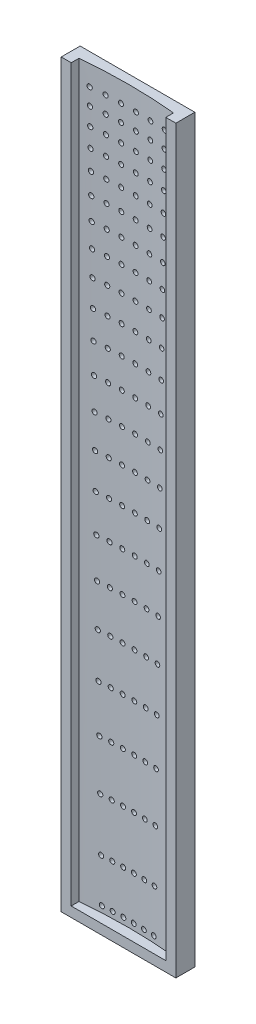
from build123d import *

# Parameters (mm, degrees)
SKETCH2_W               = 73.126
SKETCH2_H               = 465.703533893
BOSS_EXTRUDE1_DEPTH     = 12.8
SKETCH1_R               = 1.575
CUT_EXTRUDE1_DEPTH      = 12.8
CUT_EXTRUDE3_DEPTH      = 468.311966945
CUT_EXTRUDE3_DEPTH_BACK = 468.311966945
SKETCH4_W               = 73.126
SKETCH4_H               = 6.4
BOSS_EXTRUDE3_DEPTH     = 12.8
CHAMFER5_SIZE           = 0.7


with BuildPart() as part:
    # Sketch2 → Boss-Extrude1 (new body)
    with BuildSketch(Plane.XY):
        with Locations((0, 232.851766947)):
            Rectangle(SKETCH2_W, SKETCH2_H)
    extrude(amount=BOSS_EXTRUDE1_DEPTH)

    # Sketch1 → Cut-Extrude1 (cut)
    with BuildSketch(Plane.XY):
        with Locations((-16.5652, 4)):
            Circle(SKETCH1_R)
        with Locations((-9.9352, 4)):
            Circle(SKETCH1_R)
        with Locations((-3.3052, 4)):
            Circle(SKETCH1_R)
        with Locations((3.3248, 4)):
            Circle(SKETCH1_R)
        with Locations((9.9548, 4)):
            Circle(SKETCH1_R)
        with Locations((16.5848, 4)):
            Circle(SKETCH1_R)
        with Locations((-23.88043, 452.80915)):
            Circle(SKETCH1_R)
        with Locations((-14.33043, 452.80915)):
            Circle(SKETCH1_R)
        with Locations((-4.78043, 452.80915)):
            Circle(SKETCH1_R)
        with Locations((4.76957, 452.80915)):
            Circle(SKETCH1_R)
        with Locations((14.31957, 452.80915)):
            Circle(SKETCH1_R)
        with Locations((23.86957, 452.80915)):
            Circle(SKETCH1_R)
        with Locations((-23.707727265, 442.21337)):
            Circle(SKETCH1_R)
        with Locations((-14.227727265, 442.21337)):
            Circle(SKETCH1_R)
        with Locations((-4.747727265, 442.21337)):
            Circle(SKETCH1_R)
        with Locations((4.732272735, 442.21337)):
            Circle(SKETCH1_R)
        with Locations((14.212272735, 442.21337)):
            Circle(SKETCH1_R)
        with Locations((23.692272735, 442.21337)):
            Circle(SKETCH1_R)
        with Locations((-23.524755056, 430.98753)):
            Circle(SKETCH1_R)
        with Locations((-14.114755056, 430.98753)):
            Circle(SKETCH1_R)
        with Locations((-4.704755056, 430.98753)):
            Circle(SKETCH1_R)
        with Locations((4.705244944, 430.98753)):
            Circle(SKETCH1_R)
        with Locations((14.115244944, 430.98753)):
            Circle(SKETCH1_R)
        with Locations((23.525244944, 430.98753)):
            Circle(SKETCH1_R)
        with Locations((-23.330902805, 419.09417)):
            Circle(SKETCH1_R)
        with Locations((-14.000902805, 419.09417)):
            Circle(SKETCH1_R)
        with Locations((-4.670902805, 419.09417)):
            Circle(SKETCH1_R)
        with Locations((4.659097195, 419.09417)):
            Circle(SKETCH1_R)
        with Locations((13.989097195, 419.09417)):
            Circle(SKETCH1_R)
        with Locations((23.319097195, 419.09417)):
            Circle(SKETCH1_R)
        with Locations((-23.125523598, 406.4936)):
            Circle(SKETCH1_R)
        with Locations((-13.875523598, 406.4936)):
            Circle(SKETCH1_R)
        with Locations((-4.625523598, 406.4936)):
            Circle(SKETCH1_R)
        with Locations((4.624476402, 406.4936)):
            Circle(SKETCH1_R)
        with Locations((13.874476402, 406.4936)):
            Circle(SKETCH1_R)
        with Locations((23.124476402, 406.4936)):
            Circle(SKETCH1_R)
        with Locations((-22.907931725, 393.14375)):
            Circle(SKETCH1_R)
        with Locations((-13.747931725, 393.14375)):
            Circle(SKETCH1_R)
        with Locations((-4.587931725, 393.14375)):
            Circle(SKETCH1_R)
        with Locations((4.572068275, 393.14375)):
            Circle(SKETCH1_R)
        with Locations((13.732068275, 393.14375)):
            Circle(SKETCH1_R)
        with Locations((22.892068275, 393.14375)):
            Circle(SKETCH1_R)
        with Locations((-22.677401222, 379.00008)):
            Circle(SKETCH1_R)
        with Locations((-13.607401222, 379.00008)):
            Circle(SKETCH1_R)
        with Locations((-4.537401222, 379.00008)):
            Circle(SKETCH1_R)
        with Locations((4.532598778, 379.00008)):
            Circle(SKETCH1_R)
        with Locations((13.602598778, 379.00008)):
            Circle(SKETCH1_R)
        with Locations((22.672598778, 379.00008)):
            Circle(SKETCH1_R)
        with Locations((-22.433162766, 364.01539)):
            Circle(SKETCH1_R)
        with Locations((-13.463162766, 364.01539)):
            Circle(SKETCH1_R)
        with Locations((-4.493162766, 364.01539)):
            Circle(SKETCH1_R)
        with Locations((4.476837234, 364.01539)):
            Circle(SKETCH1_R)
        with Locations((13.446837234, 364.01539)):
            Circle(SKETCH1_R)
        with Locations((22.416837234, 364.01539)):
            Circle(SKETCH1_R)
        with Locations((-22.174401071, 348.13966)):
            Circle(SKETCH1_R)
        with Locations((-13.304401071, 348.13966)):
            Circle(SKETCH1_R)
        with Locations((-4.434401071, 348.13966)):
            Circle(SKETCH1_R)
        with Locations((4.435598929, 348.13966)):
            Circle(SKETCH1_R)
        with Locations((13.305598929, 348.13966)):
            Circle(SKETCH1_R)
        with Locations((22.175598929, 348.13966)):
            Circle(SKETCH1_R)
        with Locations((-21.900252606, 331.31991)):
            Circle(SKETCH1_R)
        with Locations((-13.140252606, 331.31991)):
            Circle(SKETCH1_R)
        with Locations((-4.380252606, 331.31991)):
            Circle(SKETCH1_R)
        with Locations((4.379747394, 331.31991)):
            Circle(SKETCH1_R)
        with Locations((13.139747394, 331.31991)):
            Circle(SKETCH1_R)
        with Locations((21.899747394, 331.31991)):
            Circle(SKETCH1_R)
        with Locations((-21.609802333, 313.5)):
            Circle(SKETCH1_R)
        with Locations((-12.969802333, 313.5)):
            Circle(SKETCH1_R)
        with Locations((-4.329802333, 313.5)):
            Circle(SKETCH1_R)
        with Locations((4.310197667, 313.5)):
            Circle(SKETCH1_R)
        with Locations((12.950197667, 313.5)):
            Circle(SKETCH1_R)
        with Locations((21.590197667, 313.5)):
            Circle(SKETCH1_R)
        with Locations((-21.302081101, 294.62047)):
            Circle(SKETCH1_R)
        with Locations((-12.781248101, 294.62047)):
            Circle(SKETCH1_R)
        with Locations((-4.260415101, 294.62047)):
            Circle(SKETCH1_R)
        with Locations((4.260417899, 294.62047)):
            Circle(SKETCH1_R)
        with Locations((12.781250899, 294.62047)):
            Circle(SKETCH1_R)
        with Locations((21.302083899, 294.62047)):
            Circle(SKETCH1_R)
        with Locations((-20.976061736, 274.6183)):
            Circle(SKETCH1_R)
        with Locations((-12.585636736, 274.6183)):
            Circle(SKETCH1_R)
        with Locations((-4.195211736, 274.6183)):
            Circle(SKETCH1_R)
        with Locations((4.195213264, 274.6183)):
            Circle(SKETCH1_R)
        with Locations((12.585638264, 274.6183)):
            Circle(SKETCH1_R)
        with Locations((20.976063264, 274.6183)):
            Circle(SKETCH1_R)
        with Locations((-20.630656266, 253.42674)):
            Circle(SKETCH1_R)
        with Locations((-12.378393266, 253.42674)):
            Circle(SKETCH1_R)
        with Locations((-4.126130266, 253.42674)):
            Circle(SKETCH1_R)
        with Locations((4.126132734, 253.42674)):
            Circle(SKETCH1_R)
        with Locations((12.378395734, 253.42674)):
            Circle(SKETCH1_R)
        with Locations((20.630658734, 253.42674)):
            Circle(SKETCH1_R)
        with Locations((-20.264712012, 230.97507)):
            Circle(SKETCH1_R)
        with Locations((-12.158827012, 230.97507)):
            Circle(SKETCH1_R)
        with Locations((-4.052942012, 230.97507)):
            Circle(SKETCH1_R)
        with Locations((4.052942988, 230.97507)):
            Circle(SKETCH1_R)
        with Locations((12.158827988, 230.97507)):
            Circle(SKETCH1_R)
        with Locations((20.264712988, 230.97507)):
            Circle(SKETCH1_R)
        with Locations((-19.87700751, 207.18835)):
            Circle(SKETCH1_R)
        with Locations((-11.92620451, 207.18835)):
            Circle(SKETCH1_R)
        with Locations((-3.97540151, 207.18835)):
            Circle(SKETCH1_R)
        with Locations((3.97540149, 207.18835)):
            Circle(SKETCH1_R)
        with Locations((11.92620449, 207.18835)):
            Circle(SKETCH1_R)
        with Locations((19.87700749, 207.18835)):
            Circle(SKETCH1_R)
        with Locations((-19.466248769, 181.98719)):
            Circle(SKETCH1_R)
        with Locations((-11.679749769, 181.98719)):
            Circle(SKETCH1_R)
        with Locations((-3.893250769, 181.98719)):
            Circle(SKETCH1_R)
        with Locations((3.893248231, 181.98719)):
            Circle(SKETCH1_R)
        with Locations((11.679747231, 181.98719)):
            Circle(SKETCH1_R)
        with Locations((19.466246231, 181.98719)):
            Circle(SKETCH1_R)
        with Locations((-19.031065187, 155.2875)):
            Circle(SKETCH1_R)
        with Locations((-11.418639187, 155.2875)):
            Circle(SKETCH1_R)
        with Locations((-3.806213187, 155.2875)):
            Circle(SKETCH1_R)
        with Locations((3.806212813, 155.2875)):
            Circle(SKETCH1_R)
        with Locations((11.418638813, 155.2875)):
            Circle(SKETCH1_R)
        with Locations((19.031064813, 155.2875)):
            Circle(SKETCH1_R)
        with Locations((-18.570004344, 127.00017)):
            Circle(SKETCH1_R)
        with Locations((-11.142003344, 127.00017)):
            Circle(SKETCH1_R)
        with Locations((-3.714002344, 127.00017)):
            Circle(SKETCH1_R)
        with Locations((3.713998656, 127.00017)):
            Circle(SKETCH1_R)
        with Locations((11.141999656, 127.00017)):
            Circle(SKETCH1_R)
        with Locations((18.570000656, 127.00017)):
            Circle(SKETCH1_R)
        with Locations((-18.081527269, 97.03078)):
            Circle(SKETCH1_R)
        with Locations((-10.848917269, 97.03078)):
            Circle(SKETCH1_R)
        with Locations((-3.616307269, 97.03078)):
            Circle(SKETCH1_R)
        with Locations((3.616302731, 97.03078)):
            Circle(SKETCH1_R)
        with Locations((10.848912731, 97.03078)):
            Circle(SKETCH1_R)
        with Locations((18.081522731, 97.03078)):
            Circle(SKETCH1_R)
        with Locations((-17.564003716, 65.27931)):
            Circle(SKETCH1_R)
        with Locations((-10.538402716, 65.27931)):
            Circle(SKETCH1_R)
        with Locations((-3.512801716, 65.27931)):
            Circle(SKETCH1_R)
        with Locations((3.512799284, 65.27931)):
            Circle(SKETCH1_R)
        with Locations((10.538400284, 65.27931)):
            Circle(SKETCH1_R)
        with Locations((17.564001284, 65.27931)):
            Circle(SKETCH1_R)
        with Locations((-17.015706785, 31.63981)):
            Circle(SKETCH1_R)
        with Locations((-10.209424785, 31.63981)):
            Circle(SKETCH1_R)
        with Locations((-3.403142785, 31.63981)):
            Circle(SKETCH1_R)
        with Locations((3.403139215, 31.63981)):
            Circle(SKETCH1_R)
        with Locations((10.209421215, 31.63981)):
            Circle(SKETCH1_R)
        with Locations((17.015703215, 31.63981)):
            Circle(SKETCH1_R)
    extrude(amount=CUT_EXTRUDE1_DEPTH, mode=Mode.SUBTRACT)

    # Sketch3 → Cut-Extrude3 (cut, two sides: drawn at the far end of the back side and taken through both)
    with BuildSketch(Plane(origin=(0, 0, 0), x_dir=(1, 0, 0), z_dir=(0, 1, 0)).offset(-CUT_EXTRUDE3_DEPTH_BACK)):
        with BuildLine():
            Line((30.163, -158.685232104), (30.163, -12.8))
            Line((30.163, -12.8), (30.163, -7.896136802))
            ThreePointArc((30.163, -7.896136802), (0, -6.4), (-30.163, -7.896136802))
            Line((-30.163, -7.896136802), (-30.163, -12.8))
            Line((-30.163, -12.8), (-30.163, -158.685232104))
            Line((-30.163, -158.685232104), (-30.163, -450.455696312))
            Line((-30.163, -450.455696312), (30.163, -450.455696312))
            Line((30.163, -450.455696312), (30.163, -158.685232104))
        make_face()
    extrude(amount=CUT_EXTRUDE3_DEPTH + CUT_EXTRUDE3_DEPTH_BACK, mode=Mode.SUBTRACT)

    # Sketch4 → Boss-Extrude3 (add)
    with BuildSketch(Plane.XY):
        with Locations((0, -3.2)):
            Rectangle(SKETCH4_W, SKETCH4_H)
    extrude(amount=BOSS_EXTRUDE3_DEPTH)

    # Chamfer5
    chamfer5_edges = [part.edges().sort_by_distance(p)[0] for p in [
        (0, 465.703533893, 0),
        (-36.563, 229.651766947, 0),
        (0, -6.4, 0),
        (36.563, 229.651766947, 0),
    ]]
    chamfer(chamfer5_edges, length=CHAMFER5_SIZE)


solid = part.part
